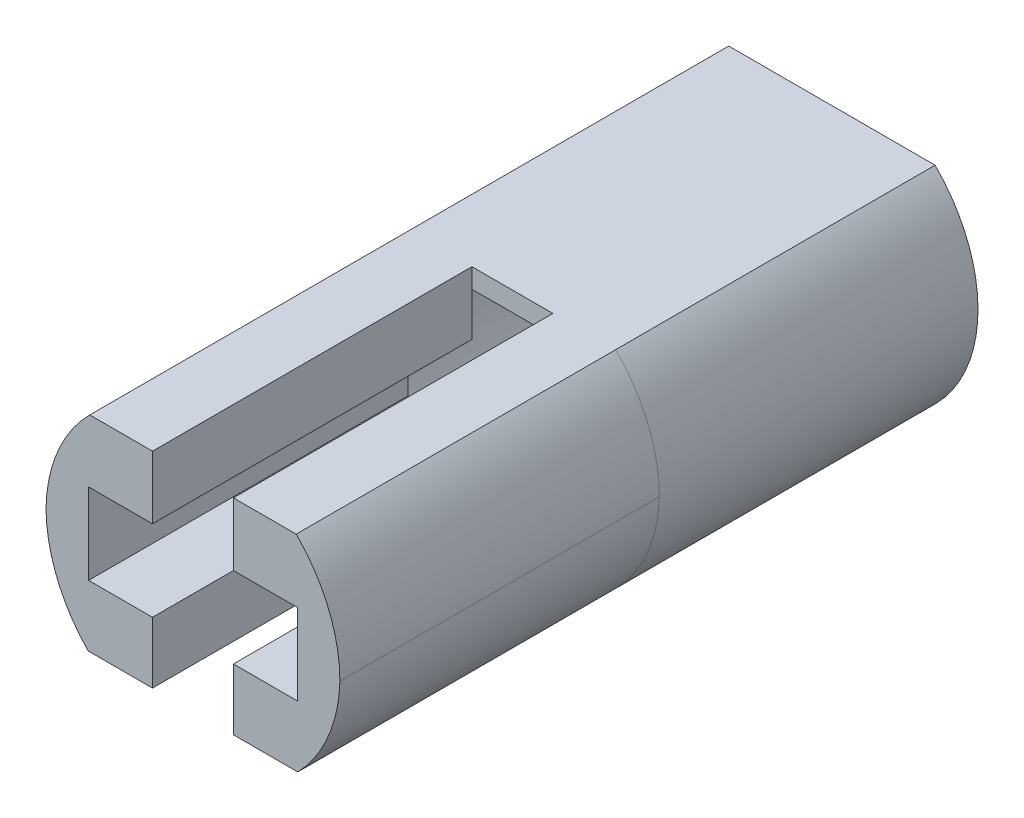
from build123d import *

# Parameters (mm, degrees)
SKETCH1_W           = 6.9
SKETCH1_H           = 6.9
BOSS_EXTRUDE1_DEPTH = 7.5
FILLET2_R           = 3.5
FILLET3_R           = 3.5
FILLET4_R           = 3.5
FILLET5_DEPTH       = 7.5
SKETCH2_R           = 3.429778851
BOSS_EXTRUDE3_DEPTH = 7.5
SKETCH4_W           = 6.879778851
SKETCH4_H           = 1.06
CUT_EXTRUDE6_DEPTH  = 15
CUT_EXTRUDE8_DEPTH  = 15


with BuildPart() as part:
    # Sketch1 → Boss-Extrude1 (new body)
    with BuildSketch(Plane.XY):
        with Locations((3.45, 3.45)):
            Rectangle(SKETCH1_W, SKETCH1_H)
        Polygon((3.45, 5.9), (4.4, 5.9), (4.4, 4.4), (5.9, 4.4), (5.9, 2.5), (4.4, 2.5), (4.4, 1), (2.5, 1), (2.5, 2.5), (1, 2.5), (1, 4.4), (2.5, 4.4), (2.5, 5.9), align=None, mode=Mode.SUBTRACT)
    extrude(amount=BOSS_EXTRUDE1_DEPTH)

    # Fillet2
    fillet2_edges = [part.edges().sort_by_distance(p)[0] for p in [
        (0, 6.9, 3.75),
    ]]
    fillet(fillet2_edges, radius=FILLET2_R)

    # Fillet3
    # the kernel refuses this fillet: 3.5 mm, written as the material it takes off along each edge
    with BuildSketch(Plane(origin=(6.9, 6.9, -8.746427842), x_dir=(-1, 0, 0), z_dir=(0, 0, 1))) as fillet3_piece_1:
        with BuildLine():
            CenterArc((3.5, 3.498571137), FILLET3_R, 180, 88.362754922)
            Line((0, 3.498571137), (-0.07, 3.498571137))
            Line((-0.07, 3.498571137), (-0.07, 0))
            Line((-0.07, 0), (0, -0.07))
            ThreePointArc((0, -0.07), (1.7, -0.07), (3.398, -0.069971423))
            Line((3.398, -0.069971423), (3.4, 0))
        make_face()
    extrude(amount=24.992855685, mode=Mode.SUBTRACT)

    # Fillet4
    # the kernel refuses this fillet: 3.5 mm, written as the material it takes off along each edge
    with BuildSketch(Plane(origin=(6.9, 0, -8.746529216), x_dir=(0, 1, 0), z_dir=(0, 0, 1))) as fillet4_piece_1:
        with BuildLine():
            CenterArc((3.5, 3.498611686), FILLET4_R, 180, 88.386155146)
            Line((0, 3.498611686), (-0.07, 3.498611686))
            Line((-0.07, 3.498611686), (-0.07, 0))
            Line((-0.07, 0), (0, -0.07))
            ThreePointArc((0, -0.07), (1.700714432, -0.07), (3.39945744, -0.069972234))
            Line((3.39945744, -0.069972234), (3.401428863, 0))
        make_face()
    extrude(amount=24.993058431, mode=Mode.SUBTRACT)

    # Fillet5: read off the stored shape, not the designer's step
    # Fillet5 outline → Fillet5 (cut)
    with BuildSketch(Plane.XY):
        with BuildLine():
            Line((0, 0), (3.401388314, 0))
            ThreePointArc((3.401388314, 0), (1.007751346, 1.041234576), (0.000347304, 3.449305272))
            ThreePointArc((0.000347304, 3.449305272), (8.6827e-05, 3.424653248), (0, 3.4))
            Line((0, 3.4), (0, 0))
        make_face()
    extrude(amount=FILLET5_DEPTH, mode=Mode.SUBTRACT)

    # Sketch2 → Boss-Extrude3 (add)
    with BuildSketch(Plane.XY):
        with Locations((3.45, 3.449305272)):
            Circle(SKETCH2_R)
        with BuildLine():
            Line((5.5103837, 5.418396181), (1.3896163, 5.418396181))
            ThreePointArc((1.3896163, 5.418396181), (0.6, 3.449305272), (1.3896163, 1.480214363))
            Line((1.3896163, 1.480214363), (5.5103837, 1.480214363))
            ThreePointArc((5.5103837, 1.480214363), (6.3, 3.449305272), (5.5103837, 5.418396181))
        make_face(mode=Mode.SUBTRACT)
    extrude(amount=-BOSS_EXTRUDE3_DEPTH)

    # Sketch4 → Cut-Extrude6 (cut)
    with BuildSketch(Plane(origin=(0, 0, -7.5), x_dir=(-1, 0, 0), z_dir=(0, 0, -1))):
        with Locations((-3.439889426, 0.53)):
            Rectangle(SKETCH4_W, SKETCH4_H)
    extrude(amount=-CUT_EXTRUDE6_DEPTH, mode=Mode.SUBTRACT)

    # Sketch6 → Cut-Extrude8 (cut)
    with BuildSketch(Plane(origin=(0, 0, -7.5), x_dir=(-1, 0, 0), z_dir=(0, 0, -1))):
        Polygon((-3.455260778, 6.975766387), (-6.044608069, 6.975766387), (-6.044608069, 5.876947105), (-3.455260778, 5.876947105), (-1.008353024, 5.876947105), (-1.008353024, 6.975766387), align=None)
    extrude(amount=-CUT_EXTRUDE8_DEPTH, mode=Mode.SUBTRACT)


solid = part.part
